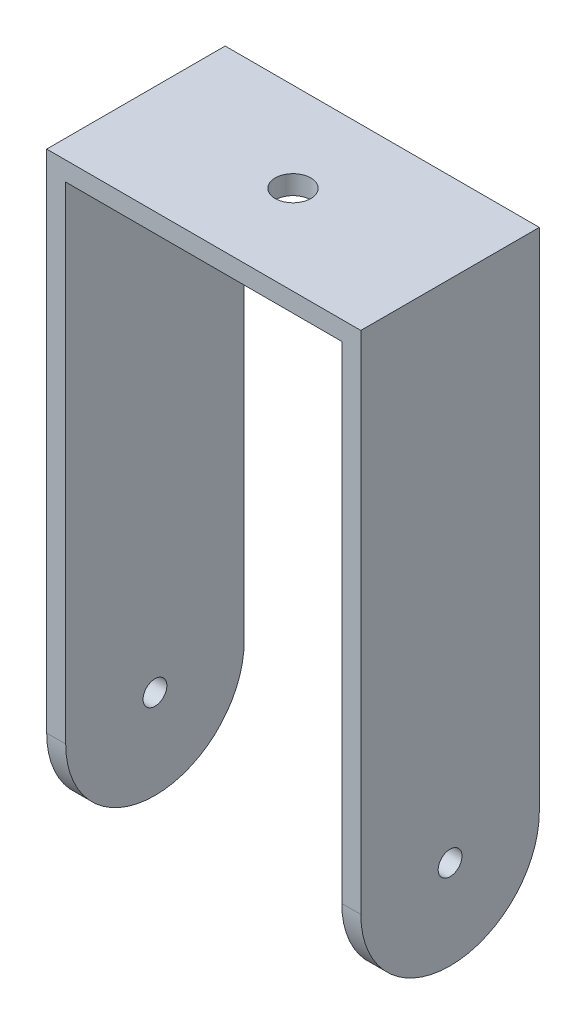
from build123d import *

# Parameters (mm, degrees)
BOSS_EXTRUDE1_DEPTH = 75
SKETCH2_R           = 7.5
CUT_EXTRUDE1_DEPTH  = 8
SKETCH3_R           = 5
CUT_EXTRUDE2_DEPTH  = 134
FILLET1_R           = 37.5


with BuildPart() as part:
    # Sketch1 → Boss-Extrude1 (new body)
    with BuildSketch(Plane.XY):
        Polygon((124, -250), (132, -250), (132, 0), (0, 0), (0, -250), (8, -250), (8, -8), (124, -8), align=None)
    extrude(amount=BOSS_EXTRUDE1_DEPTH)

    # Sketch2 → Cut-Extrude1 (cut)
    with BuildSketch(Plane(origin=(0, 0, 0), x_dir=(1, 0, 0), z_dir=(0, 1, 0))):
        with Locations(Location((66, -37.5, 0), (0, 0, 270))):
            Circle(SKETCH2_R)
    extrude(amount=-CUT_EXTRUDE1_DEPTH, mode=Mode.SUBTRACT)

    # Sketch3 → Cut-Extrude2 (cut)
    with BuildSketch(Plane(origin=(132, 0, 0), x_dir=(0, 0, -1), z_dir=(1, 0, 0))):
        with Locations(Location((-37.5, -212.5, 0), (0, 0, 90))):
            Circle(SKETCH3_R)
    extrude(amount=-CUT_EXTRUDE2_DEPTH, mode=Mode.SUBTRACT)

    # Fillet1
    fillet1_edges = [part.edges().sort_by_distance(p)[0] for p in [
        (128, -250, 75),
        (4, -250, 75),
        (4, -250, 0),
        (128, -250, 0),
    ]]
    fillet(fillet1_edges, radius=FILLET1_R - 0.0001)  # a hair under: the kernel refuses the full size


solid = part.part
